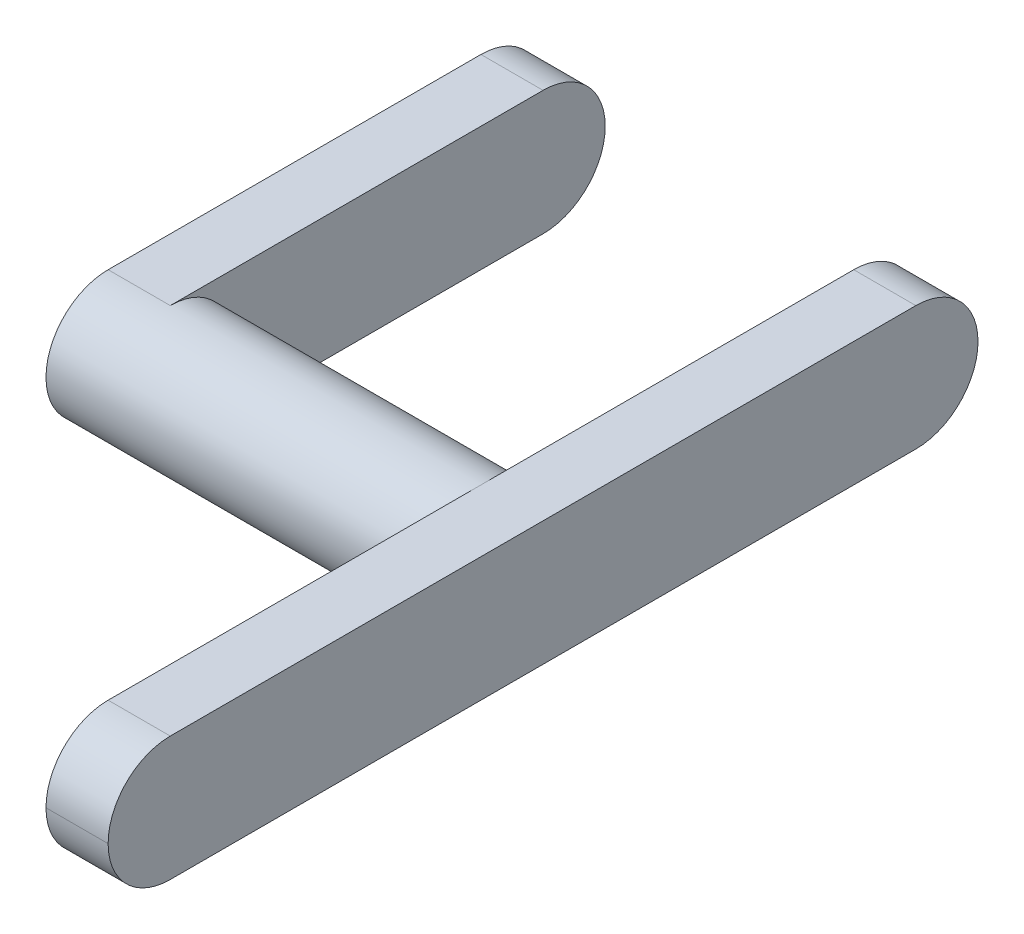
from build123d import *
from build123d.topology import SkipClean

# Parameters (mm, degrees)
IZIM1_W                     = 5
IZIM1_H                     = 70
Y_KSEKLIK_EKSTR_ZYON1_DEPTH = 10
IZIM3_R                     = 3.5
KES_EKSTR_ZYON2_DEPTH       = 3.5
IZIM2_R                     = 5
Y_KSEKLIK_EKSTR_ZYON4_DEPTH = 25
RADYUS1_R                   = 5
Y_KSEKLIK_EKSTR_ZYON5_DEPTH = 5


with BuildPart() as part:
    # Çizim1 → Yükseklik-Ekstrüzyon1 (new body)
    with BuildSketch(Plane(origin=(0, 0, 0), x_dir=(1, 0, 0), z_dir=(0, 1, 0))):
        with Locations((2.5, 35)):
            Rectangle(IZIM1_W, IZIM1_H)
    extrude(amount=Y_KSEKLIK_EKSTR_ZYON1_DEPTH)

    # Çizim3 → Kes-Ekstrüzyon2 (cut)
    with BuildSketch(Plane.ZY):
        with Locations((-5, 5)):
            Circle(IZIM3_R)
        with BuildLine():
            ThreePointArc((-5.305535476, 1.513361494), (-8.5, 5), (-5.305535476, 8.486638506))
            Line((-5.305535476, 8.486638506), (-12, 7.9))
            Line((-12, 7.9), (-12, 2.1))
            Line((-12, 2.1), (-5.305535476, 1.513361494))
        make_face()
    extrude(amount=-KES_EKSTR_ZYON2_DEPTH, mode=Mode.SUBTRACT)

    # Çizim2 → Yükseklik-Ekstrüzyon4 (add)
    with BuildSketch(Plane.ZY):
        with Locations(Location((-35, 5, 0), (0, 0, 270))):
            Circle(IZIM2_R)
    extrude(amount=Y_KSEKLIK_EKSTR_ZYON4_DEPTH)

    # Radyus1
    radyus1_edges = [part.edges().sort_by_distance(p)[0] for p in [
        (2.5, 0, -70),
        (2.5, 0, 0),
        (2.5, 10, 0),
        (2.5, 10, -70),
    ]]
    fillet(radyus1_edges, radius=RADYUS1_R - 0.0001)  # a hair under: the kernel refuses the full size

    # Çizim4 → Yükseklik-Ekstrüzyon5 (add)
    with SkipClean():  # the faces are left unmerged after this step: merging them gives an invalid solid
        with BuildSketch(Plane.ZY.offset(25)):
            with BuildLine():
                Line((-35, 0), (-65, 0))
                ThreePointArc((-65, 0), (-70, 5), (-65, 10))
                Line((-65, 10), (-35, 10))
                ThreePointArc((-35, 10), (-30, 5), (-35, 0))
            make_face()
        extrude(amount=Y_KSEKLIK_EKSTR_ZYON5_DEPTH)
    add(part.part.scale(1), mode=Mode.REPLACE)  # the faces are merged on a copy


solid = part.part
